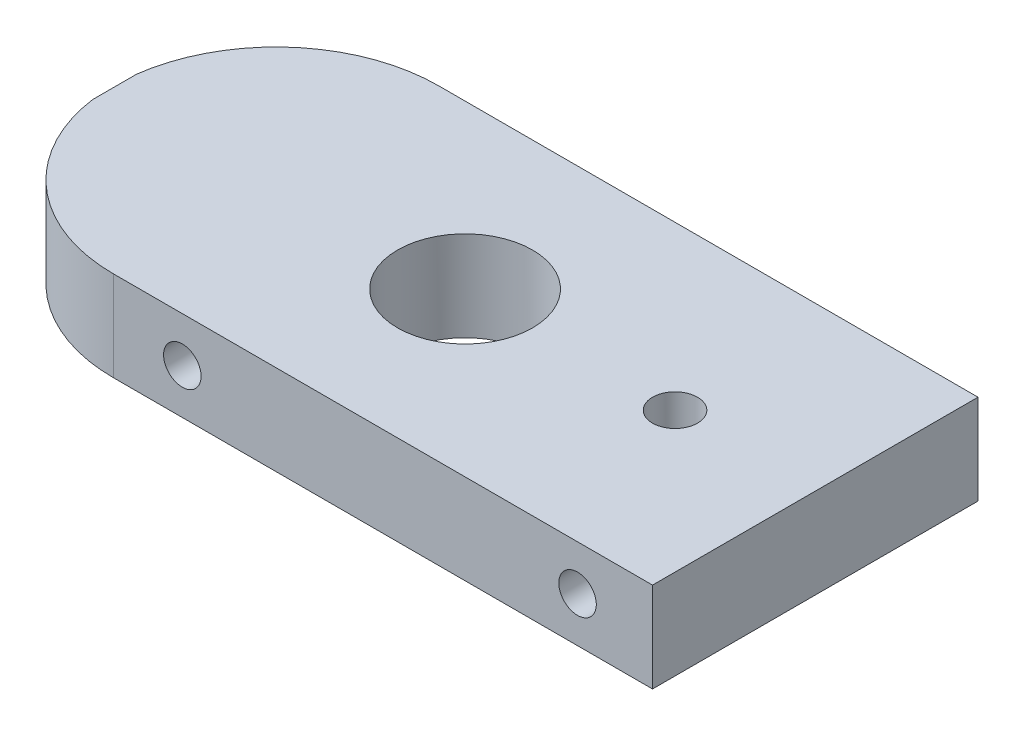
from build123d import *

# Parameters (mm, degrees)
AUFSATZ_LINEAR_AUSTRAGEN1_DEPTH      = 10.85
AUFSATZ_LINEAR_AUSTRAGEN1_DEPTH_BACK = 10.85
SKIZZE3_W                            = 46.7
SKIZZE3_H                            = 6
SCHNITT_LINEAR_START                 = 618
SKIZZE4_R                            = 4.5
SKIZZE4_R_2                          = 1.5
SCHNITT_LINEAR_AUSTRAGEN1_DEPTH      = 10
SCHNITT_LINEAR_START_2               = 10.85
SKIZZE6_R                            = 1.25
SCHNITT_LINEAR_AUSTRAGEN2_DEPTH      = 6
SCHNITT_LINEAR_START_3               = -4.85
SKIZZE6_2_R                          = 1.25
SCHNITT_LINEAR_AUSTRAGEN3_DEPTH      = 6
SCHNITT_LINEAR_START_4               = 612
SCHNITT_LINEAR_AUSTRAGEN4_DEPTH      = 6


# Read off the part's stored shape, not the designer's step: Schnitt-Linear austragen4
with BuildPart() as part:
    # Skizze3 → Aufsatz-Linear austragen1 (new, two sides: drawn at the far end of the back side and taken through both)
    with BuildSketch(Plane.XY.offset(-AUFSATZ_LINEAR_AUSTRAGEN1_DEPTH_BACK)):
        with Locations((0, 615)):
            Rectangle(SKIZZE3_W, SKIZZE3_H)
    extrude(amount=AUFSATZ_LINEAR_AUSTRAGEN1_DEPTH + AUFSATZ_LINEAR_AUSTRAGEN1_DEPTH_BACK)

    # Skizze4 → Schnitt-Linear austragen1 (cut)
    with BuildSketch(Plane(origin=(0, 0, 0), x_dir=(1, 0, 0), z_dir=(0, 1, 0)).offset(SCHNITT_LINEAR_START)):
        with Locations(Location((0, 0, 0), (0, 0, 270))):
            Circle(SKIZZE4_R)
        with Locations(Location((14, 0, 0), (0, 0, 270))):
            Circle(SKIZZE4_R_2)
    extrude(amount=-SCHNITT_LINEAR_AUSTRAGEN1_DEPTH, mode=Mode.SUBTRACT)

    # Skizze6 → Schnitt-Linear austragen2 (cut)
    with BuildSketch(Plane.XY.offset(SCHNITT_LINEAR_START_2)):
        with Locations(Location((18.35, 615, 0), (0, 0, 180))):
            Circle(SKIZZE6_R)
        with Locations(Location((-8, 615, 0), (0, 0, 180))):
            Circle(SKIZZE6_R)
    extrude(amount=-SCHNITT_LINEAR_AUSTRAGEN2_DEPTH, mode=Mode.SUBTRACT)

    # Skizze6<2> → Schnitt-Linear austragen3 (cut)
    with BuildSketch(Plane.XY.offset(SCHNITT_LINEAR_START_3)):
        with Locations((18.35, 234)):
            Circle(SKIZZE6_2_R)
        with Locations((-8, 234)):
            Circle(SKIZZE6_2_R)
        with Locations(Location((18.35, 615, 0), (0, 0, 180))):
            Circle(SKIZZE6_2_R)
        with Locations(Location((-8, 615, 0), (0, 0, 180))):
            Circle(SKIZZE6_2_R)
    extrude(amount=-SCHNITT_LINEAR_AUSTRAGEN3_DEPTH, mode=Mode.SUBTRACT)

    # Schnitt-Linear austragen4 outline → Schnitt-Linear austragen4 (cut)
    with BuildSketch(Plane(origin=(0, 0, 0), x_dir=(1, 0, 0), z_dir=(0, 1, 0)).offset(SCHNITT_LINEAR_START_4)):
        with BuildLine():
            Line((-23.35, 10.85), (-23.35, 1.469693846))
            ThreePointArc((-23.35, 1.469693846), (-19.733593827, 8.17522716), (-12.6, 10.85))
            Line((-12.6, 10.85), (-23.35, 10.85))
        make_face()
        with BuildLine():
            ThreePointArc((-12.6, -10.85), (-19.733593827, -8.17522716), (-23.35, -1.469693846))
            Line((-23.35, -1.469693846), (-23.35, -10.85))
            Line((-23.35, -10.85), (-12.6, -10.85))
        make_face()
    extrude(amount=SCHNITT_LINEAR_AUSTRAGEN4_DEPTH, mode=Mode.SUBTRACT)


solid = part.part
